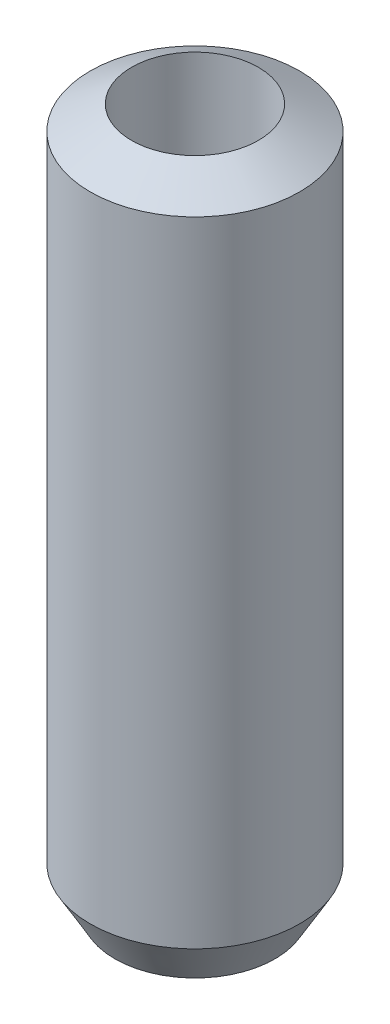
from build123d import *

# Parameters (mm, degrees)
SKETCH1_R           = 25
BOSS_EXTRUDE1_DEPTH = 167.350946
SKETCH2_R           = 15.136636065
CUT_EXTRUDE1_DEPTH  = 172.044845368
CHAMFER1_SIZE       = 5.878201
CHAMFER1_SIZE_2     = 10.181343


with BuildPart() as part:
    # Sketch1 → Boss-Extrude1 (new body)
    with BuildSketch(Plane(origin=(0, 0, 0), x_dir=(1, 0, 0), z_dir=(0, 1, 0))):
        with Locations(Location((0, 0, 0), (0, 0, 270))):
            Circle(SKETCH1_R)
    extrude(amount=BOSS_EXTRUDE1_DEPTH)

    # Sketch2 → Cut-Extrude1 (cut, through all)
    with BuildSketch(Plane(origin=(0, 0, 0), x_dir=(1, 0, 0), z_dir=(0, 1, 0))):
        with Locations(Location((0, 0, 0), (0, 0, 270))):
            Circle(SKETCH2_R)
    extrude(amount=CUT_EXTRUDE1_DEPTH, mode=Mode.SUBTRACT)

    # Chamfer1
    # the kernel refuses this chamfer: 10.181343, 5.878201 mm, written as the material it takes off along each edge
    with BuildSketch(Plane(origin=(0, 167.350946, 0), x_dir=(0, 0, 1), z_dir=(-1, 0, 0))) as chamfer1_piece_1:
        Polygon((25, -CHAMFER1_SIZE), (25 - CHAMFER1_SIZE_2, 0), (25, 0), align=None)
    revolve(axis=Axis((0, 167.350946, 0), (0, 1, 0)), mode=Mode.SUBTRACT)
    with BuildSketch(Plane(origin=(0, 0, 0), x_dir=(0, 0, 1), z_dir=(-1, 0, 0))) as chamfer1_piece_2:
        Polygon((25, CHAMFER1_SIZE_2), (25 - CHAMFER1_SIZE, 0), (25, 0), align=None)
    revolve(axis=Axis((0, 0, 0), (0, 1, 0)), mode=Mode.SUBTRACT)


solid = part.part
